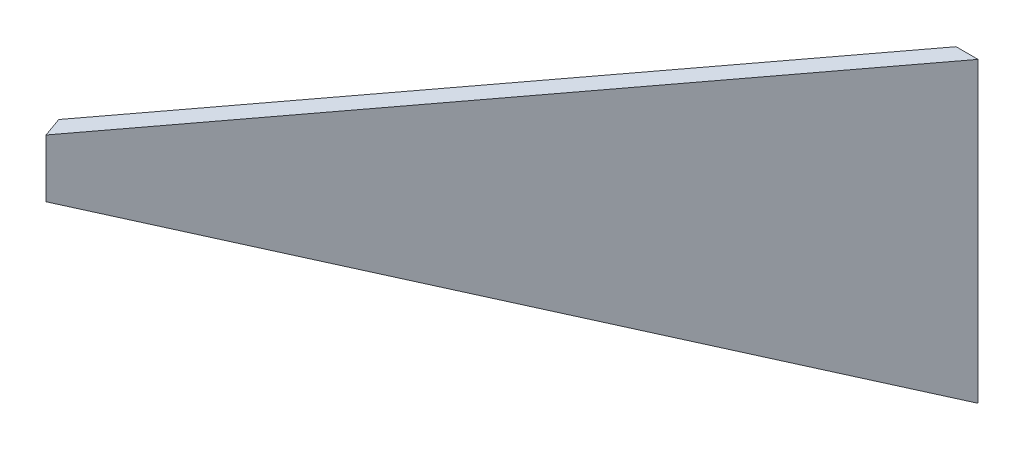
from build123d import *

# Parameters (mm, degrees)
BOSS_EXTRUDE1_DEPTH = 152.4
SKETCH3_OUTSIDE_W   = 273.93
SKETCH3_OUTSIDE_H   = 229.576
CUT_EXTRUDE2_DEPTH  = 381.660734008
SHELL1_T            = -6.35
CUT_EXTRUDE3_DEPTH  = 381.660734008
SKETCH5_OUTSIDE_W   = 357.828
SKETCH5_OUTSIDE_H   = 272.896
CUT_EXTRUDE4_DEPTH  = 332.131034202


with BuildPart() as part:
    # Sketch2 → Boss-Extrude1 (new body)
    with BuildSketch(Plane(origin=(0, 0, 0), x_dir=(1, 0, 0), z_dir=(0, 1, 0))):
        Polygon((-57.15, 0), (224.536, 0), (-24.357683353, -196.753899884), align=None)
    extrude(amount=BOSS_EXTRUDE1_DEPTH)

    # Sketch3 outside → Cut-Extrude2 (cut, through all)
    with BuildSketch(Plane(origin=(-63.5, 0, 0), x_dir=(0, 0, -1), z_dir=(1, 0, 0))):
        with Locations((-98.377, 76.2)):
            Rectangle(SKETCH3_OUTSIDE_W, SKETCH3_OUTSIDE_H)
        Polygon((0, 152.4), (-152.4, 107.95), (-261.257142857, 76.2), (-152.4, 44.45), (0, 0), align=None, mode=Mode.SUBTRACT)
    extrude(amount=CUT_EXTRUDE2_DEPTH, mode=Mode.SUBTRACT)

    # Shell1
    shell1_openings = [part.faces().sort_by_distance(p)[0] for p in [
        (83.693, 76.2, 0),
    ]]
    offset(amount=SHELL1_T, openings=shell1_openings, kind=Kind.INTERSECTION)

    # Sketch4 → Cut-Extrude3 (cut, through all)
    with BuildSketch(Plane(origin=(-63.5, 0, 0), x_dir=(0, 0, -1), z_dir=(1, 0, 0))):
        Polygon((0, 152.4), (0, 145.785416667), (-196.753899884, 88.398862534), (-196.753899884, 95.013445867), align=None)
        Polygon((-196.753899884, 64.001137466), (0, 6.614583333), (0, 0), (-196.753899884, 57.386554133), align=None)
    extrude(amount=CUT_EXTRUDE3_DEPTH, mode=Mode.SUBTRACT)

    # Sketch5 outside → Cut-Extrude4 (cut, through all)
    with BuildSketch(Plane(origin=(0, 149.86, 0), x_dir=(1, 0, 0), z_dir=(0, 1, 0))):
        with Locations((83.693, -98.377)):
            Rectangle(SKETCH5_OUTSIDE_W, SKETCH5_OUTSIDE_H)
        Polygon((-19.861548271, -185.105168304), (-18.669521453, -192.257329212), (344.317071882, -192.257329212), (317.879717865, 72.864270331), (-35.136715197, 43.31663937), align=None, mode=Mode.SUBTRACT)
    extrude(amount=-CUT_EXTRUDE4_DEPTH, mode=Mode.SUBTRACT)


solid = part.part
